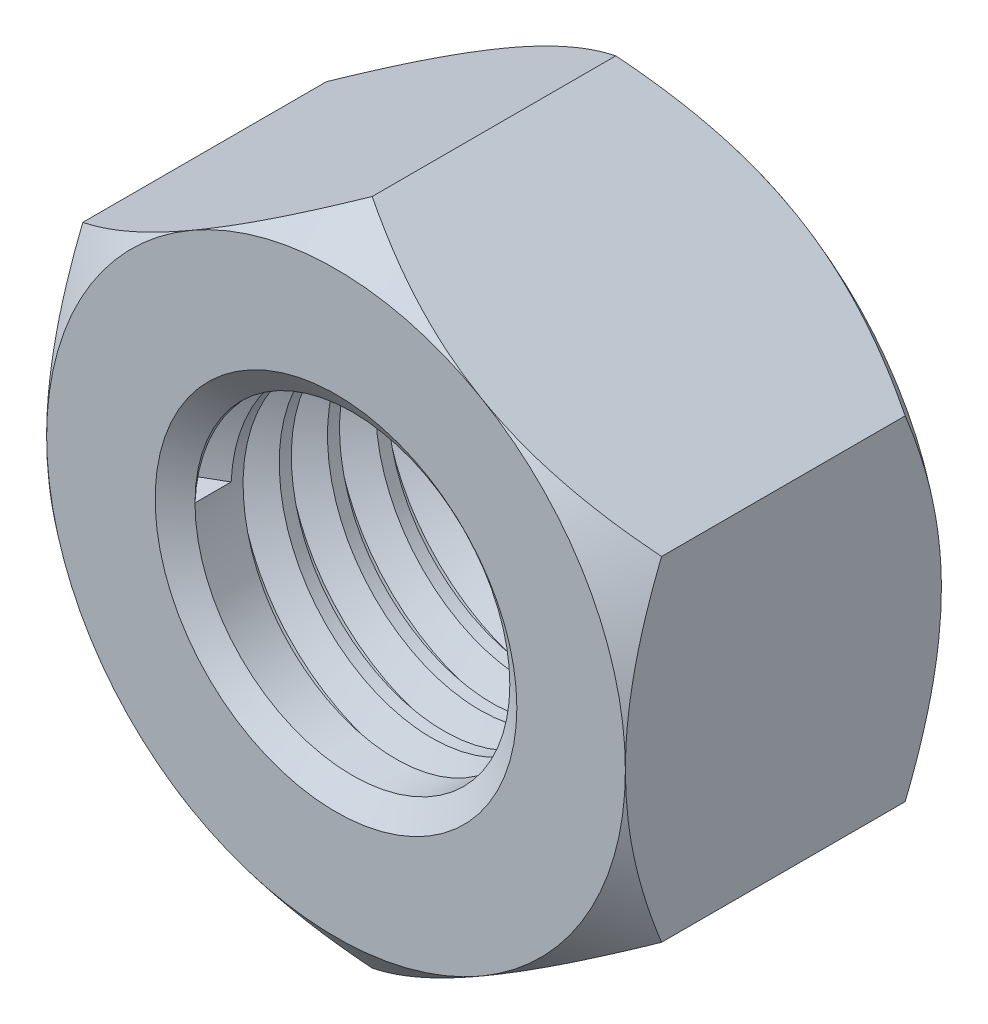
from build123d import *

# Parameters (mm, degrees)
BASENUTSKE_R  = 3.4544
BASENUT_DEPTH = 6.9342
THREAD1_PITCH = 1.058333333


with BuildPart() as part:
    # BaseNutSke → BaseNut (new body)
    with BuildSketch(Plane.XY):
        Polygon((6.35, 3.666174209), (6.35, -3.666174209), (0, -7.332348419), (-6.35, -3.666174209), (-6.35, 3.666174209), (0, 7.332348419), align=None)
        Circle(BASENUTSKE_R, mode=Mode.SUBTRACT)
    extrude(amount=-BASENUT_DEPTH)

    # Sketch3 → Double-Chamfer (revolve, cut)
    with BuildSketch(Plane(origin=(0, 0, 0), x_dir=(0, 0, -1), z_dir=(1, 0, 0))):
        Polygon((6.9342, 6.35), (6.14045, 7.332348419), (6.14045, 20.032348419), (19.6342, 20.032348419), (19.6342, 6.35), align=None)
        Polygon((0.79375, 20.032348419), (-12.7, 20.032348419), (-12.7, 6.35), (0, 6.35), (0.79375, 7.332348419), align=None)
    revolve(axis=Axis((0, 0, 0), (0, 0, -1)), mode=Mode.SUBTRACT)

    # Sketch5 → EndChamfer (revolve, cut)
    with BuildSketch(Plane(origin=(0, 0, 0), x_dir=(0, 0, -1), z_dir=(1, 0, 0)), mode=Mode.PRIVATE) as endchamfer_sk:
        Polygon((6.9088, 3.96875), (6.512633078, 3.402965), (6.9596, 3.402965), (6.9596, 3.96875), align=None)
        Polygon((-0.0508, 3.96875), (0, 3.96875), (0.396166922, 3.402965), (-0.0508, 3.402965), align=None)
    revolve(endchamfer_sk.sketch.rotate(Axis((0, 0, -25.037505729), (0, 0, -1)), 90), axis=Axis((0, 0, -25.037505729), (0, 0, -1)), mode=Mode.SUBTRACT)

    # Thread1: the profile of Thread Profile1 profile screwed along a right-hand helix of 5.847398 turns, 8 arcs to a turn; built about Z, then put on its axis
    thread1_z = Axis((0, 0, 0), (0, 0, 1))
    thread1_corners = [(3.4541, 0, -0.000173205), (4.027239718, 0, 0.330729165), (4.027239718, 0, 0.463020832), (3.4541, 0, 0.793923202)]
    with BuildLine(mode=Mode.PRIVATE) as thread1_profile:
        Line(thread1_corners[0], thread1_corners[1])
        Line(thread1_corners[1], thread1_corners[2])
        Line(thread1_corners[2], thread1_corners[3])
        Line(thread1_corners[3], thread1_corners[0])
    thread1_cap = Face(thread1_profile.wire())
    thread1_turn_angles = [0, 22.5, 45, 67.5, 90, 112.5, 135, 157.5, 180, 202.5, 225, 247.5, 270, 292.5, 315, 337.5, 360]
    thread1_turn_weights = [1, 0.9238795325112867, 1, 0.9238795325112867, 1, 0.9238795325112867, 1, 0.9238795325112867, 1, 0.9238795325112867, 1, 0.9238795325112867, 1, 0.9238795325112867, 1, 0.9238795325112867, 1]
    thread1_turn_rails = [Edge.make_bspline([Vector(p[0], p[1], 0).rotate(thread1_z, thread1_turn_angles[k]) / thread1_turn_weights[k] + Vector(0, 0, p[2] + THREAD1_PITCH * thread1_turn_angles[k] / 360) for k in range(17)], [0, 0, 0, 1, 1, 2, 2, 3, 3, 4, 4, 5, 5, 6, 6, 7, 7, 8, 8, 8], 2, thread1_turn_weights) for p in thread1_corners]
    thread1_turn_sides = [Face.make_surface_from_curves(thread1_turn_rails[p[0]], thread1_turn_rails[p[1]]) for p in [(0, 1), (1, 2), (2, 3), (3, 0)]]
    thread1_last_angles = [1800, 1822.5, 1845, 1867.5, 1890, 1912.5, 1935, 1957.5, 1980, 2002.5, 2025, 2047.5, 2070, 2087.531689115, 2105.06337823]
    thread1_last_weights = [1, 0.9238795325112867, 1, 0.9238795325112867, 1, 0.9238795325112867, 1, 0.9238795325112867, 1, 0.9238795325112867, 1, 0.9238795325112867, 1, 0.9535504907068157, 1]
    thread1_last_rails = [Edge.make_bspline([Vector(p[0], p[1], 0).rotate(thread1_z, thread1_last_angles[k]) / thread1_last_weights[k] + Vector(0, 0, p[2] + THREAD1_PITCH * thread1_last_angles[k] / 360) for k in range(15)], [0, 0, 0, 1, 1, 2, 2, 3, 3, 4, 4, 5, 5, 6, 6, 7, 7, 7], 2, thread1_last_weights) for p in thread1_corners]
    thread1_last_sides = [Face.make_surface_from_curves(thread1_last_rails[p[0]], thread1_last_rails[p[1]]) for p in [(0, 1), (1, 2), (2, 3), (3, 0)]]
    thread1 = Plane(origin=(0, 0, -0.360151747), x_dir=(-1, 0, 0), z_dir=(0, 0, -1)) * Solid(Shell([*[p.moved(Location((0, 0, THREAD1_PITCH * i))) for i in range(5) for p in thread1_turn_sides], *thread1_last_sides, thread1_cap, thread1_cap.rotate(thread1_z, 2105.06337823).moved(Location((0, 0, THREAD1_PITCH * 2105.06337823 / 360)))]))
    add(thread1, mode=Mode.SUBTRACT)


solid = part.part
